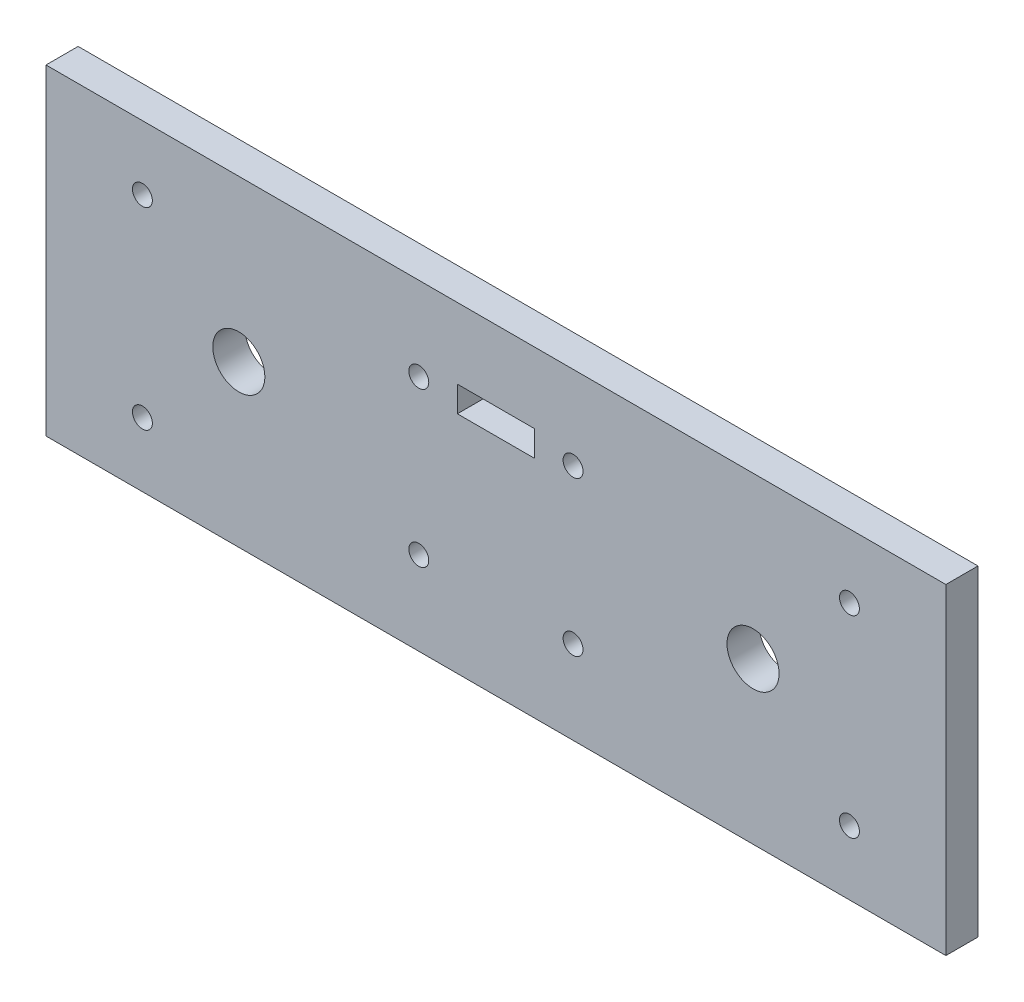
from build123d import *

# Parameters (mm, degrees)
ESQUISSE1_W        = 140
ESQUISSE1_H        = 50
ESQUISSE1_R        = 4.05
ESQUISSE1_R_2      = 1.55
ESQUISSE1_W_2      = 12
ESQUISSE1_H_2      = 4
BOSS_EXTRU_1_DEPTH = 5


with BuildPart() as part:
    # Esquisse1 → Boss.-Extru.1 (new body)
    with BuildSketch(Plane.XY):
        Rectangle(ESQUISSE1_W, ESQUISSE1_H)
        with Locations((-40, 0)):
            Circle(ESQUISSE1_R, mode=Mode.SUBTRACT)
        with Locations((-55, -15)):
            Circle(ESQUISSE1_R_2, mode=Mode.SUBTRACT)
        with Locations((-55, 15)):
            Circle(ESQUISSE1_R_2, mode=Mode.SUBTRACT)
        with Locations((55, -15)):
            Circle(ESQUISSE1_R_2, mode=Mode.SUBTRACT)
        with Locations((55, 15)):
            Circle(ESQUISSE1_R_2, mode=Mode.SUBTRACT)
        with Locations((40, 0)):
            Circle(ESQUISSE1_R, mode=Mode.SUBTRACT)
        with Locations((-12, 12)):
            Circle(ESQUISSE1_R_2, mode=Mode.SUBTRACT)
        with Locations((-12, -12)):
            Circle(ESQUISSE1_R_2, mode=Mode.SUBTRACT)
        with Locations((12, -12)):
            Circle(ESQUISSE1_R_2, mode=Mode.SUBTRACT)
        with Locations((12, 12)):
            Circle(ESQUISSE1_R_2, mode=Mode.SUBTRACT)
        with Locations((0, 12)):
            Rectangle(ESQUISSE1_W_2, ESQUISSE1_H_2, mode=Mode.SUBTRACT)
    extrude(amount=-BOSS_EXTRU_1_DEPTH)


solid = part.part
